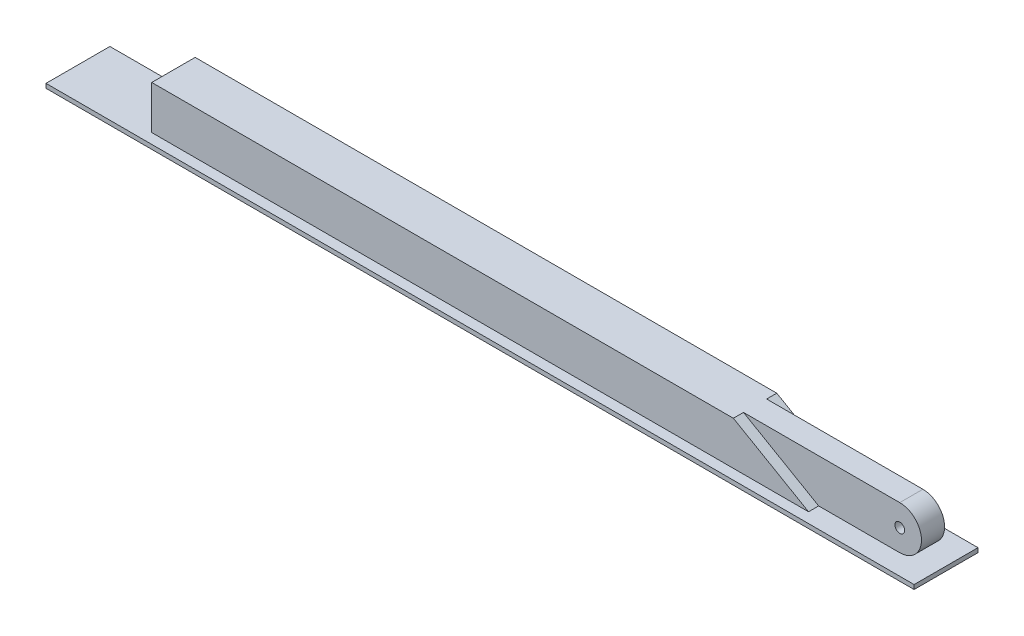
from build123d import *

# Parameters (mm, degrees)
BOSS_EXTRUDE1_DEPTH      = 15
H_0_266_DIAMETER_HOLE1_D = 6.7564
SKETCH5_W                = 40
SKETCH5_H                = 16
SKETCH5_H_2              = 20.916111238
CUT_EXTRUDE1_DEPTH       = 243.332416321
SKETCH6_W                = 429.036778435
SKETCH6_H                = 127.431795429
CUT_EXTRUDE2_DEPTH       = 243.332416321
SKETCH10_W               = 30
SKETCH10_H               = 30
BOSS_EXTRUDE3_DEPTH      = 500
SKETCH11_R               = 9.525
CUT_EXTRUDE4_DEPTH       = 400
SKETCH13_W               = 600
SKETCH13_H               = 44.158972604
BOSS_EXTRUDE4_DEPTH      = 3
SKETCH14_W               = 111.034909532
SKETCH14_H               = 112.185530356
CUT_EXTRUDE5_DEPTH       = 30
CHAMFER1_SIZE            = 100
CHAMFER1_SIZE_2          = 57.735026919


with BuildPart() as part:
    # Sketch1 → Boss-Extrude1 (new, symmetric)
    with BuildSketch(Plane.XY):
        with BuildLine():
            Line((-225, 15), (225, 15))
            ThreePointArc((225, 15), (240, 0), (225, -15))
            Line((225, -15), (-225, -15))
            ThreePointArc((-225, -15), (-240, 0), (-225, 15))
        make_face()
    extrude(amount=BOSS_EXTRUDE1_DEPTH, both=True)

    # H (0.266) Diameter Hole1 (through all)
    with Locations(Plane.XY.offset(15)):
        with Locations((-225, 0), (225, 0)):
            Hole(H_0_266_DIAMETER_HOLE1_D / 2)

    # Sketch5 → Cut-Extrude1 (cut, through all)
    with BuildSketch(Plane(origin=(0, 15, 0), x_dir=(1, 0, 0), z_dir=(0, 1, 0))):
        with Locations((-237, 0)):
            Rectangle(SKETCH5_W, SKETCH5_H)
        with Locations((237, 18.458055619)):
            Rectangle(SKETCH5_W, SKETCH5_H_2)
        with Locations((237, -18.458055619)):
            Rectangle(SKETCH5_W, SKETCH5_H_2)
    extrude(amount=-CUT_EXTRUDE1_DEPTH, mode=Mode.SUBTRACT)

    # Sketch6 → Cut-Extrude2 (cut, through all)
    with BuildSketch(Plane(origin=(0, 15, 0), x_dir=(1, 0, 0), z_dir=(0, 1, 0))):
        with Locations((-47.518389218, -4.674139215)):
            Rectangle(SKETCH6_W, SKETCH6_H)
    extrude(amount=-CUT_EXTRUDE2_DEPTH, mode=Mode.SUBTRACT)

    # Sketch10 → Boss-Extrude3 (add)
    with BuildSketch(Plane.ZY.offset(-167)):
        Rectangle(SKETCH10_W, SKETCH10_H)
    extrude(amount=BOSS_EXTRUDE3_DEPTH)

    # Sketch11 → Cut-Extrude4 (cut)
    with BuildSketch(Plane.ZY.offset(333)):
        with Locations((0, 3)):
            Circle(SKETCH11_R)
    extrude(amount=-CUT_EXTRUDE4_DEPTH, mode=Mode.SUBTRACT)

    # Sketch13 → Boss-Extrude4 (add)
    with BuildSketch(Plane(origin=(0, -15, 0), x_dir=(-1, 0, 0), z_dir=(0, -1, 0))):
        with Locations((51, 0)):
            Rectangle(SKETCH13_W, SKETCH13_H)
    extrude(amount=BOSS_EXTRUDE4_DEPTH)

    # Sketch14 → Cut-Extrude5 (cut)
    with BuildSketch(Plane(origin=(0, 15, 0), x_dir=(1, 0, 0), z_dir=(0, 1, 0))):
        with Locations((-340.517454766, -2.301241648)):
            Rectangle(SKETCH14_W, SKETCH14_H)
    extrude(amount=-CUT_EXTRUDE5_DEPTH, mode=Mode.SUBTRACT)

    # Chamfer1
    # the kernel refuses this chamfer: 100, 57.735026919 mm, written as the material it takes off along each edge
    with BuildSketch(Plane(origin=(217, 15, 250.708575465), x_dir=(-0.9998132206222079, 0.01932676561270057, 2.717178209496515e-15), z_dir=(0, 0, -1))) as chamfer1_piece_1_section:
        Polygon((CHAMFER1_SIZE * 0.999813220622, -CHAMFER1_SIZE * 0.0193267656127), (-CHAMFER1_SIZE_2 * 0.0193267656127, -CHAMFER1_SIZE_2 * 0.999813220622), (0, 0), align=None)
    chamfer1_piece_1 = extrude(amount=524.417150929, mode=Mode.PRIVATE)
    chamfer1_piece_1 = split(chamfer1_piece_1, bisect_by=Plane(origin=(178.470505911, -15, 11.5), z_dir=(0, 1, 0)), keep=Keep.TOP, mode=Mode.PRIVATE)
    chamfer1_piece_1 = split(chamfer1_piece_1, bisect_by=Plane(origin=(178.470505911, 1.75500065, 8), z_dir=(0, 0, 1)), keep=Keep.TOP, mode=Mode.PRIVATE)
    add(chamfer1_piece_1, mode=Mode.SUBTRACT)
    with BuildSketch(Plane(origin=(217, 15, -8), x_dir=(-0.9998132206222079, 0.019326765612700587, 2.717178209496515e-15), z_dir=(0, 0, -1))) as chamfer1_piece_2_section:
        Polygon((CHAMFER1_SIZE * 0.999813220622, -CHAMFER1_SIZE * 0.0193267656127), (-CHAMFER1_SIZE_2 * 0.0193267656127, -CHAMFER1_SIZE_2 * 0.999813220622), (0, 0), align=None)
    chamfer1_piece_2 = extrude(amount=265.708575465, mode=Mode.PRIVATE)
    chamfer1_piece_2 = split(chamfer1_piece_2, bisect_by=Plane(origin=(178.470505911, -15, -11.5), z_dir=(0, 1, 0)), keep=Keep.TOP, mode=Mode.PRIVATE)
    add(chamfer1_piece_2, mode=Mode.SUBTRACT)
    with BuildSketch(Plane(origin=(217, 15, -250.708575465), x_dir=(0.057893862402671484, -0.9983227437537925, 0), z_dir=(0, 0, 1))) as chamfer1_piece_3_section:
        Polygon((CHAMFER1_SIZE_2 * 0.998322743753, -CHAMFER1_SIZE_2 * 0.0578938624026), (-CHAMFER1_SIZE * 0.0578938624027, -CHAMFER1_SIZE * 0.998322743754), (0, 0), align=None)
    chamfer1_piece_3 = extrude(amount=524.417150929, mode=Mode.PRIVATE)
    chamfer1_piece_3 = split(chamfer1_piece_3, bisect_by=Plane(origin=(178.470505911, -15, -11.5), z_dir=(0, 1, 0)), keep=Keep.TOP, mode=Mode.PRIVATE)
    chamfer1_piece_3 = split(chamfer1_piece_3, bisect_by=Plane(origin=(178.470505911, 1.75500065, -8), z_dir=(0, 0, -1)), keep=Keep.TOP, mode=Mode.PRIVATE)
    add(chamfer1_piece_3, mode=Mode.SUBTRACT)
    with BuildSketch(Plane(origin=(217, 15, 8), x_dir=(0.05789386240267099, -0.9983227437537925, 0), z_dir=(0, 0, 1))) as chamfer1_piece_4_section:
        Polygon((CHAMFER1_SIZE_2 * 0.998322743753, -CHAMFER1_SIZE_2 * 0.0578938624026), (-CHAMFER1_SIZE * 0.0578938624027, -CHAMFER1_SIZE * 0.998322743754), (0, 0), align=None)
    chamfer1_piece_4 = extrude(amount=265.708575465, mode=Mode.PRIVATE)
    chamfer1_piece_4 = split(chamfer1_piece_4, bisect_by=Plane(origin=(178.470505911, -15, 11.5), z_dir=(0, 1, 0)), keep=Keep.TOP, mode=Mode.PRIVATE)
    add(chamfer1_piece_4, mode=Mode.SUBTRACT)


solid = part.part
